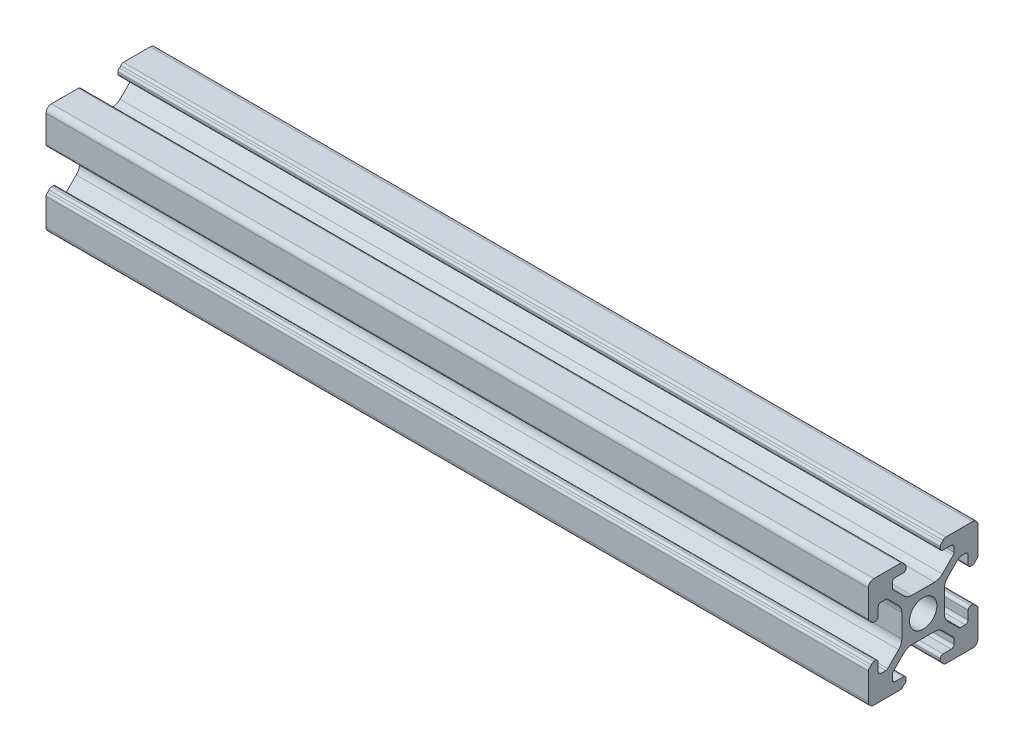
from build123d import *

# Parameters (mm, degrees)
SKETCH1_W                = 20
SKETCH1_H                = 20
BOSS_EXTRUDE1_DEPTH      = 150
FILLET1_R                = 1
CUT_EXTRUDE1_DEPTH       = 151.665191733
F_5_0_5_DIAMETER_HOLE1_D = 5
FILLET2_R                = 2
FILLET3_R                = 0.5
FILLET4_R                = 0.5
FILLET5_R                = 0.5


with BuildPart() as part:
    # Sketch1 → Boss-Extrude1 (new body)
    with BuildSketch(Plane(origin=(0, 0, 0), x_dir=(0, 0, -1), z_dir=(1, 0, 0))):
        Rectangle(SKETCH1_W, SKETCH1_H)
    extrude(amount=BOSS_EXTRUDE1_DEPTH)

    # Fillet1
    fillet1_edges = [part.edges().sort_by_distance(p)[0] for p in [
        (75, 10, 10),
        (75, 10, -10),
        (75, -10, -10),
        (75, -10, 10),
    ]]
    fillet(fillet1_edges, radius=FILLET1_R)

    # Sketch3 → Cut-Extrude1 (cut, through all)
    with BuildSketch(Plane.ZY):
        Polygon((-3.6, 10), (3.6, 10), (3.6, 9.5), (3.1, 9.5), (3.1, 8.2), (5.63, 8.2), (5.63, 6.619949494), (2.910050506, 3.9), (-2.910050506, 3.9), (-5.63, 6.619949494), (-5.63, 8.2), (-3.1, 8.2), (-3.1, 9.5), (-3.6, 9.5), align=None)
        Polygon((10, 3.6), (10, -3.6), (9.5, -3.6), (9.5, -3.1), (8.2, -3.1), (8.2, -5.63), (6.619949494, -5.63), (3.9, -2.910050506), (3.9, 2.910050506), (6.619949494, 5.63), (8.2, 5.63), (8.2, 3.1), (9.5, 3.1), (9.5, 3.6), align=None)
        Polygon((3.6, -10), (-3.6, -10), (-3.6, -9.5), (-3.1, -9.5), (-3.1, -8.2), (-5.63, -8.2), (-5.63, -6.619949494), (-2.910050506, -3.9), (2.910050506, -3.9), (5.63, -6.619949494), (5.63, -8.2), (3.1, -8.2), (3.1, -9.5), (3.6, -9.5), align=None)
        Polygon((-10, -3.6), (-10, 3.6), (-9.5, 3.6), (-9.5, 3.1), (-8.2, 3.1), (-8.2, 5.63), (-6.619949494, 5.63), (-3.9, 2.910050506), (-3.9, -2.910050506), (-6.619949494, -5.63), (-8.2, -5.63), (-8.2, -3.1), (-9.5, -3.1), (-9.5, -3.6), align=None)
    extrude(amount=-CUT_EXTRUDE1_DEPTH, mode=Mode.SUBTRACT)

    # Ø5.0 (5) Diameter Hole1 (through all)
    with Locations(Plane.ZY):
        with Locations((0, 0)):
            Hole(F_5_0_5_DIAMETER_HOLE1_D / 2)

    # Fillet2
    fillet2_edges = [part.edges().sort_by_distance(p)[0] for p in [
        (75, -3.9, -2.910050506),
        (75, -3.9, 2.910050506),
        (75, 2.910050506, -3.9),
        (75, -2.910050506, -3.9),
        (75, -2.910050506, 3.9),
        (75, 2.910050506, 3.9),
        (75, 3.9, 2.910050506),
        (75, 3.9, -2.910050506),
    ]]
    fillet(fillet2_edges, radius=FILLET2_R)

    # Fillet3
    fillet3_edges = [part.edges().sort_by_distance(p)[0] for p in [
        (75, 3.6, -10),
        (75, 3.1, -9.5),
        (75, 3.1, -8.2),
        (75, 5.63, -8.2),
        (75, 5.63, -6.619949494),
        (75, 3.6, 10),
        (75, 3.1, 9.5),
        (75, 3.1, 8.2),
        (75, 5.63, 8.2),
        (75, 5.63, 6.619949494),
        (75, 6.619949494, 5.63),
        (75, 8.2, 5.63),
        (75, 8.2, 3.1),
        (75, 9.5, 3.1),
        (75, 10, 3.6),
        (75, 9.5, -3.1),
        (75, 10, -3.6),
        (75, 8.2, -3.1),
        (75, 8.2, -5.63),
        (75, 6.619949494, -5.63),
    ]]
    fillet(fillet3_edges, radius=FILLET3_R - 0.0001)  # a hair under: the kernel refuses the full size

    # Fillet4
    fillet4_edges = [part.edges().sort_by_distance(p)[0] for p in [
        (75, -3.6, 10),
        (75, -3.1, 9.5),
        (75, -3.1, 8.2),
        (75, -5.63, 8.2),
        (75, -5.63, 6.619949494),
        (75, -6.619949494, 5.63),
        (75, -8.2, 5.63),
        (75, -8.2, 3.1),
        (75, -10, 3.6),
        (75, -9.5, 3.1),
        (75, -10, -3.6),
        (75, -9.5, -3.1),
        (75, -8.2, -3.1),
        (75, -8.2, -5.63),
        (75, -6.619949494, -5.63),
        (75, -5.63, -6.619949494),
        (75, -5.63, -8.2),
        (75, -3.1, -8.2),
        (75, -3.1, -9.5),
        (75, -3.6, -10),
    ]]
    fillet(fillet4_edges, radius=FILLET4_R - 0.0001)  # a hair under: the kernel refuses the full size

    # Fillet5
    fillet5_edges = [part.edges().sort_by_distance(p)[0] for p in [
        (75, 3.6, 9.5),
        (75, 9.5, 3.6),
        (75, 9.5, -3.6),
        (75, 3.6, -9.5),
        (75, -3.6, 9.5),
        (75, -9.5, 3.6),
        (75, -9.5, -3.6),
        (75, -3.6, -9.5),
    ]]
    fillet(fillet5_edges, radius=FILLET5_R)


solid = part.part
